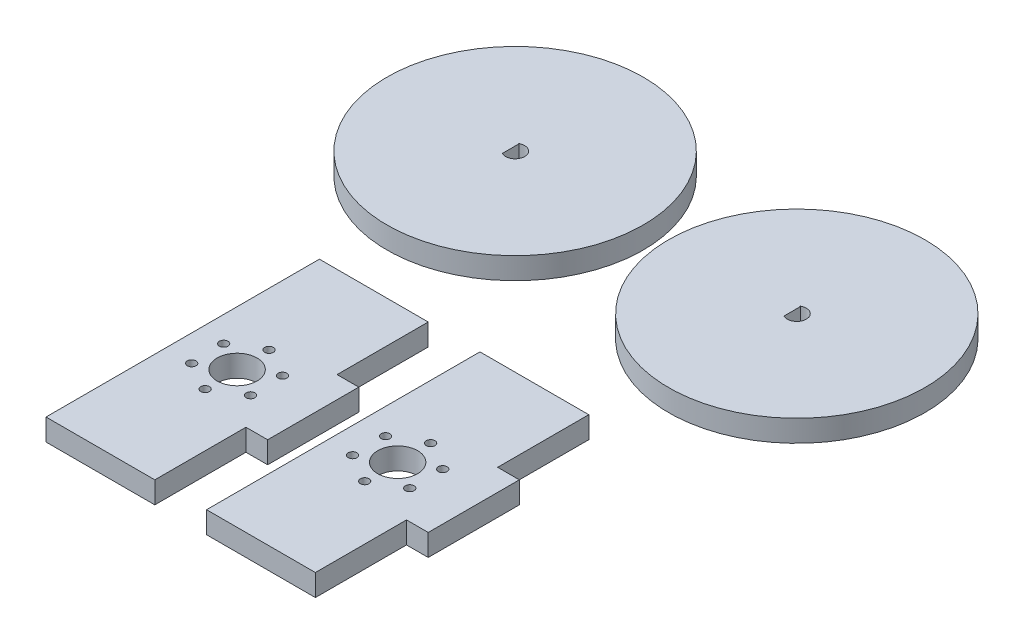
from build123d import *

# Parameters (mm, degrees)
MOTORIZED_START                      = -12.251519109
MOTORIZED_PLATFORM_MDF_OUTLINE_R     = 1.27
MOTORIZED_PLATFORM_MDF_OUTLINE_R_2   = 5.842
MOTORIZED_PLATFORM_MDF_DEPTH         = 6.35
MOTORIZED_PLATFORM_MDF_2_OUTLINE_R   = 37.5
MOTORIZED_PLATFORM_MDF_2_DEPTH       = 6.35
MOTORIZED_PLATFORM_MDF_3_OUTLINE_R   = 1.27
MOTORIZED_PLATFORM_MDF_3_OUTLINE_R_2 = 5.842
MOTORIZED_PLATFORM_MDF_3_DEPTH       = 6.35
MOTORIZED_START_2                    = -12.251519108
MOTORIZED_PLATFORM_MDF_4_OUTLINE_R   = 37.5
MOTORIZED_PLATFORM_MDF_4_DEPTH       = 6.35
MOTORIZED_PLATFORM_MDF_5_OUTLINE_W   = 6.35
MOTORIZED_PLATFORM_MDF_5_OUTLINE_H   = 8.382
MOTORIZED_PLATFORM_MDF_5_OUTLINE_H_2 = 4.7625
MOTORIZED_PLATFORM_MDF_5_OUTLINE_W_2 = 4.7625
MOTORIZED_PLATFORM_MDF_5_OUTLINE_H_3 = 6.35
MOTORIZED_PLATFORM_MDF_5_OUTLINE_R   = 3.175
MOTORIZED_PLATFORM_MDF_5_OUTLINE_R_2 = 12.7
MOTORIZED_PLATFORM_MDF_5_DEPTH       = 6.35
MOTORIZED_PLATFORM_MDF_6_DEPTH       = 6.35
MOTORIZED_PLATFORM_MDF_7_DEPTH       = 6.35
MOTORIZED_PLATFORM_MDF_8_DEPTH       = 6.35
MOTORIZED_PLATFORM_MDF_9_DEPTH       = 6.35


with BuildPart() as part:
    # Motorized Platform MDF: read off the stored shape, not the designer's step
    # Motorized Platform MDF outline → Motorized Platform MDF (new body)
    with BuildSketch(Plane(origin=(0, 0, 0), x_dir=(1, 0, 0), z_dir=(0, 1, 0)).offset(MOTORIZED_START)):
        Polygon((102.260824506, -253.915186521), (102.260824506, -227.248519855), (108.610824506, -227.248519855), (108.610824506, -200.581853188), (102.260824506, -200.581853188), (102.260824506, -173.915186521), (70.418955754, -173.915186521), (70.418955754, -253.915186521), align=None)
        with Locations((77.981012933, -218.741186531)):
            Circle(MOTORIZED_PLATFORM_MDF_OUTLINE_R, mode=Mode.SUBTRACT)
        with Locations((86.33989013, -223.567186531)):
            Circle(MOTORIZED_PLATFORM_MDF_OUTLINE_R, mode=Mode.SUBTRACT)
        with Locations((86.33989013, -213.915186531)):
            Circle(MOTORIZED_PLATFORM_MDF_OUTLINE_R_2, mode=Mode.SUBTRACT)
        with Locations((94.698767327, -218.741186531)):
            Circle(MOTORIZED_PLATFORM_MDF_OUTLINE_R, mode=Mode.SUBTRACT)
        with Locations((77.981012933, -209.089186531)):
            Circle(MOTORIZED_PLATFORM_MDF_OUTLINE_R, mode=Mode.SUBTRACT)
        with Locations((86.33989013, -204.263186531)):
            Circle(MOTORIZED_PLATFORM_MDF_OUTLINE_R, mode=Mode.SUBTRACT)
        with Locations((94.698767327, -209.089186531)):
            Circle(MOTORIZED_PLATFORM_MDF_OUTLINE_R, mode=Mode.SUBTRACT)
    extrude(amount=MOTORIZED_PLATFORM_MDF_DEPTH)


with BuildPart() as body_2:
    # Motorized Platform MDF 2 outline → Motorized Platform MDF 2 (new body)
    with BuildSketch(Plane(origin=(0, 0, 0), x_dir=(1.0, 1.07258646409036e-12, 0), z_dir=(-1.07258646409036e-12, 1.0, 0)).offset(MOTORIZED_START)):
        with Locations((122.488955754, -71.766463003)):
            Circle(MOTORIZED_PLATFORM_MDF_2_OUTLINE_R)
        with BuildLine():
            Line((121.218955754, -69.413822237), (120.981800344, -69.413822237))
            ThreePointArc((120.981800344, -69.413822237), (125.279609539, -71.629760962), (121.218955754, -74.255144582))
            Line((121.218955754, -74.255144582), (121.218955754, -69.413822237))
        make_face(mode=Mode.SUBTRACT)
    extrude(amount=MOTORIZED_PLATFORM_MDF_2_DEPTH)


with BuildPart() as body_3:
    # Motorized Platform MDF 3 outline → Motorized Platform MDF 3 (new body)
    with BuildSketch(Plane(origin=(0, 0, 0), x_dir=(1, 0, 0), z_dir=(0, 1, 0)).offset(MOTORIZED_START)):
        Polygon((-228.031044246, -253.915186521), (-228.031044246, -227.248519848), (-221.681044246, -227.248519848), (-221.681044246, -200.581853175), (-228.031044246, -200.581853175), (-228.031044246, -173.915186501), (-259.872912998, -173.915186501), (-259.872912998, -253.915186521), align=None)
        with Locations((-252.159469118, -218.99437973)):
            Circle(MOTORIZED_PLATFORM_MDF_3_OUTLINE_R, mode=Mode.SUBTRACT)
        with Locations((-243.657013512, -223.562678392)):
            Circle(MOTORIZED_PLATFORM_MDF_3_OUTLINE_R, mode=Mode.SUBTRACT)
        with Locations((-235.449523016, -218.483485173)):
            Circle(MOTORIZED_PLATFORM_MDF_3_OUTLINE_R, mode=Mode.SUBTRACT)
        with Locations((-252.454434228, -209.346887849)):
            Circle(MOTORIZED_PLATFORM_MDF_3_OUTLINE_R, mode=Mode.SUBTRACT)
        with Locations((-243.951978622, -213.915186511)):
            Circle(MOTORIZED_PLATFORM_MDF_3_OUTLINE_R_2, mode=Mode.SUBTRACT)
        with Locations((-244.246943732, -204.267694631)):
            Circle(MOTORIZED_PLATFORM_MDF_3_OUTLINE_R, mode=Mode.SUBTRACT)
        with Locations((-235.744488126, -208.835993293)):
            Circle(MOTORIZED_PLATFORM_MDF_3_OUTLINE_R, mode=Mode.SUBTRACT)
    extrude(amount=MOTORIZED_PLATFORM_MDF_3_DEPTH)


with BuildPart() as body_4:
    # Motorized Platform MDF 4 outline → Motorized Platform MDF 4 (new body)
    with BuildSketch(Plane(origin=(0, 0, 0), x_dir=(1.0, 1.07258646409036e-12, 0), z_dir=(-1.07258646409036e-12, 1.0, 0)).offset(MOTORIZED_START_2)):
        with Locations((-272.481044246, -71.766463003)):
            Circle(MOTORIZED_PLATFORM_MDF_4_OUTLINE_R)
        with BuildLine():
            Line((-273.751044246, -69.413822237), (-273.988199656, -69.413822237))
            ThreePointArc((-273.988199656, -69.413822237), (-269.69039046, -71.629760962), (-273.751044246, -74.255144582))
            Line((-273.751044246, -74.255144582), (-273.751044246, -69.413822237))
        make_face(mode=Mode.SUBTRACT)
    extrude(amount=MOTORIZED_PLATFORM_MDF_4_DEPTH)


with BuildPart() as body_5:
    # Motorized Platform MDF 5 outline → Motorized Platform MDF 5 (new body)
    with BuildSketch(Plane(origin=(0, 0, 0), x_dir=(1, 0, 0), z_dir=(0, 1, 0)).offset(MOTORIZED_START)):
        Polygon((-208.981044246, -127.548519858), (-208.981044246, -154.215186531), (-215.331044246, -154.215186531), (-215.331044246, -253.915186521), (64.068955754, -253.915186521), (64.068955754, -154.215186531), (57.718955754, -154.215186531), (57.718955754, -127.548519858), (51.368955754, -127.548519858), (51.368955754, -100.881853185), (57.718955754, -100.881853185), (57.718955754, -74.215186511), (64.068955754, -74.215186511), (64.068955754, 25.484813479), (-215.331044246, 25.484813479), (-215.331044246, -74.215186511), (-208.981044246, -74.215186511), (-208.981044246, -100.881853185), (-202.631044246, -100.881853185), (-202.631044246, -127.548519858), align=None)
        with Locations((-135.956044246, -230.674186521)):
            Rectangle(MOTORIZED_PLATFORM_MDF_5_OUTLINE_W, MOTORIZED_PLATFORM_MDF_5_OUTLINE_H, mode=Mode.SUBTRACT)
        Polygon((-113.797132761, -156.871403096), (-117.164728806, -160.238999142), (-121.654856867, -155.748871081), (-118.287260821, -152.381275036), align=None, mode=Mode.SUBTRACT)
        Polygon((-94.56808489, -168.229921702), (-96.390614737, -172.629897976), (-102.257249768, -170.19985818), (-100.434719921, -165.799881906), align=None, mode=Mode.SUBTRACT)
        Polygon((-127.215739631, -139.018862197), (-131.615715905, -140.841392043), (-134.0457557, -134.974757012), (-129.645779427, -133.152227165), align=None, mode=Mode.SUBTRACT)
        with Locations((-15.306044246, -230.674186521)):
            Rectangle(MOTORIZED_PLATFORM_MDF_5_OUTLINE_W, MOTORIZED_PLATFORM_MDF_5_OUTLINE_H, mode=Mode.SUBTRACT)
        with Locations((-75.631044246, -173.746436521)):
            Rectangle(MOTORIZED_PLATFORM_MDF_5_OUTLINE_W, MOTORIZED_PLATFORM_MDF_5_OUTLINE_H_2, mode=Mode.SUBTRACT)
        Polygon((-50.827368571, -165.799881906), (-49.004838724, -170.19985818), (-54.871473755, -172.629897976), (-56.694003602, -168.229921702), align=None, mode=Mode.SUBTRACT)
        Polygon((-32.974827671, -152.381275036), (-29.607231626, -155.748871081), (-34.097359686, -160.238999142), (-37.464955731, -156.871403096), align=None, mode=Mode.SUBTRACT)
        Polygon((-21.616309065, -133.152227165), (-17.216332792, -134.974757012), (-19.646372587, -140.841392043), (-24.046348861, -139.018862197), align=None, mode=Mode.SUBTRACT)
        with Locations((-135.162294246, -114.215186521)):
            Rectangle(MOTORIZED_PLATFORM_MDF_5_OUTLINE_W_2, MOTORIZED_PLATFORM_MDF_5_OUTLINE_H_3, mode=Mode.SUBTRACT)
        Polygon((-129.645779427, -95.278145877), (-134.0457557, -93.455616031), (-131.615715905, -87.588980999), (-127.215739631, -89.411510846), align=None, mode=Mode.SUBTRACT)
        Polygon((-118.287260821, -76.049098007), (-121.654856867, -72.681501961), (-117.164728806, -68.191373901), (-113.797132761, -71.558969946), align=None, mode=Mode.SUBTRACT)
        Polygon((-100.434719921, -62.630491136), (-102.257249768, -58.230514862), (-96.390614737, -55.800475067), (-94.56808489, -60.20045134), align=None, mode=Mode.SUBTRACT)
        with Locations((-107.381044246, -25.315186521)):
            Circle(MOTORIZED_PLATFORM_MDF_5_OUTLINE_R, mode=Mode.SUBTRACT)
        with Locations((-135.956044246, 2.243813479)):
            Rectangle(MOTORIZED_PLATFORM_MDF_5_OUTLINE_W, MOTORIZED_PLATFORM_MDF_5_OUTLINE_H, mode=Mode.SUBTRACT)
        with Locations((-107.381044246, 12.784813479)):
            Circle(MOTORIZED_PLATFORM_MDF_5_OUTLINE_R, mode=Mode.SUBTRACT)
        with Locations((-75.631044246, -114.215186521)):
            Circle(MOTORIZED_PLATFORM_MDF_5_OUTLINE_R_2, mode=Mode.SUBTRACT)
        with Locations((-16.099794246, -114.215186521)):
            Rectangle(MOTORIZED_PLATFORM_MDF_5_OUTLINE_W_2, MOTORIZED_PLATFORM_MDF_5_OUTLINE_H_3, mode=Mode.SUBTRACT)
        Polygon((-24.046348861, -89.411510846), (-19.646372587, -87.588980999), (-17.216332792, -93.455616031), (-21.616309065, -95.278145877), align=None, mode=Mode.SUBTRACT)
        with Locations((-75.631044246, -54.683936521)):
            Rectangle(MOTORIZED_PLATFORM_MDF_5_OUTLINE_W, MOTORIZED_PLATFORM_MDF_5_OUTLINE_H_2, mode=Mode.SUBTRACT)
        Polygon((-56.694003602, -60.20045134), (-54.871473755, -55.800475067), (-49.004838724, -58.230514862), (-50.827368571, -62.630491136), align=None, mode=Mode.SUBTRACT)
        Polygon((-37.464955731, -71.558969946), (-34.097359686, -68.191373901), (-29.607231626, -72.681501961), (-32.974827671, -76.049098007), align=None, mode=Mode.SUBTRACT)
        with Locations((-43.881044246, -25.315186521)):
            Circle(MOTORIZED_PLATFORM_MDF_5_OUTLINE_R, mode=Mode.SUBTRACT)
        with Locations((-43.881044246, 12.784813479)):
            Circle(MOTORIZED_PLATFORM_MDF_5_OUTLINE_R, mode=Mode.SUBTRACT)
        with Locations((-15.306044246, 2.243813479)):
            Rectangle(MOTORIZED_PLATFORM_MDF_5_OUTLINE_W, MOTORIZED_PLATFORM_MDF_5_OUTLINE_H, mode=Mode.SUBTRACT)
    extrude(amount=MOTORIZED_PLATFORM_MDF_5_DEPTH)


with BuildPart() as body_6:
    # Motorized Platform MDF 6 outline → Motorized Platform MDF 6 (new body)
    with BuildSketch(Plane(origin=(0, 0, 0), x_dir=(1, 0, 0), z_dir=(0, 1, 0)).offset(MOTORIZED_START)):
        with BuildLine():
            Line((97.935622421, 57.234813479), (106.402289087, 57.234813479))
            ThreePointArc((106.402289087, 57.234813479), (93.702289087, 69.934813479), (81.002289087, 57.234813479))
            Line((81.002289087, 57.234813479), (89.468955754, 57.234813479))
            Line((89.468955754, 57.234813479), (89.468955754, 50.884813479))
            Line((89.468955754, 50.884813479), (97.935622421, 50.884813479))
            Line((97.935622421, 50.884813479), (97.935622421, 57.234813479))
        make_face()
    extrude(amount=MOTORIZED_PLATFORM_MDF_6_DEPTH)


with BuildPart() as body_7:
    # Motorized Platform MDF 7 outline → Motorized Platform MDF 7 (new body)
    with BuildSketch(Plane(origin=(0, 0, 0), x_dir=(1, 0, 0), z_dir=(0, 1, 0)).offset(MOTORIZED_START)):
        with BuildLine():
            Line((-3.664377579, 57.234813479), (4.802289087, 57.234813479))
            ThreePointArc((4.802289087, 57.234813479), (-7.897710913, 69.934813479), (-20.597710913, 57.234813479))
            Line((-20.597710913, 57.234813479), (-12.131044246, 57.234813479))
            Line((-12.131044246, 57.234813479), (-12.131044246, 50.884813479))
            Line((-12.131044246, 50.884813479), (-3.664377579, 50.884813479))
            Line((-3.664377579, 50.884813479), (-3.664377579, 57.234813479))
        make_face()
    extrude(amount=MOTORIZED_PLATFORM_MDF_7_DEPTH)


with BuildPart() as body_8:
    # Motorized Platform MDF 8 outline → Motorized Platform MDF 8 (new body)
    with BuildSketch(Plane(origin=(0, 0, 0), x_dir=(1, 0, 0), z_dir=(0, 1, 0)).offset(MOTORIZED_START)):
        with BuildLine():
            Line((-105.264377579, 57.234813479), (-96.797710913, 57.234813479))
            ThreePointArc((-96.797710913, 57.234813479), (-109.497710913, 69.934813479), (-122.197710913, 57.234813479))
            Line((-122.197710913, 57.234813479), (-113.731044246, 57.234813479))
            Line((-113.731044246, 57.234813479), (-113.731044246, 50.884813479))
            Line((-113.731044246, 50.884813479), (-105.264377579, 50.884813479))
            Line((-105.264377579, 50.884813479), (-105.264377579, 57.234813479))
        make_face()
    extrude(amount=MOTORIZED_PLATFORM_MDF_8_DEPTH)


with BuildPart() as body_9:
    # Motorized Platform MDF 9 outline → Motorized Platform MDF 9 (new body)
    with BuildSketch(Plane(origin=(0, 0, 0), x_dir=(1, 0, 0), z_dir=(0, 1, 0)).offset(MOTORIZED_START)):
        with BuildLine():
            Line((-206.864377579, 57.234813479), (-198.397710913, 57.234813479))
            ThreePointArc((-198.397710913, 57.234813479), (-211.097710913, 69.934813479), (-223.797710913, 57.234813479))
            Line((-223.797710913, 57.234813479), (-215.331044246, 57.234813479))
            Line((-215.331044246, 57.234813479), (-215.331044246, 50.884813479))
            Line((-215.331044246, 50.884813479), (-206.864377579, 50.884813479))
            Line((-206.864377579, 50.884813479), (-206.864377579, 57.234813479))
        make_face()
    extrude(amount=MOTORIZED_PLATFORM_MDF_9_DEPTH)


with BuildPart() as body_4_1:
    # Body-Move/Copy1: moved
    add(body_4.part.moved(Location((283.308205777, 0, 0))))


with BuildPart() as body_3_1:
    # Body-Move/Copy1: moved
    add(body_3.part.moved(Location((283.308205777, 0, 0))))


with BuildPart() as body_2_1:
    # Body-Move/Copy2: moved
    add(body_2.part.moved(Location((0, 0, 46.115253355))))


with BuildPart() as body_4_2:
    # Body-Move/Copy2: moved
    add(body_4_1.part.moved(Location((0, 0, 46.115253355))))


with BuildPart() as body_4_3:
    # Body-Move/Copy3: moved
    add(body_4_2.part.moved(Location((13.847893126, 0, 0))))


with BuildPart() as body_2_2:
    # Body-Move/Copy4: moved
    add(body_2_1.part.moved(Location((-15.395150419, 0, 0))))


solid = Compound([part.part, body_3_1.part, body_4_3.part, body_2_2.part])
